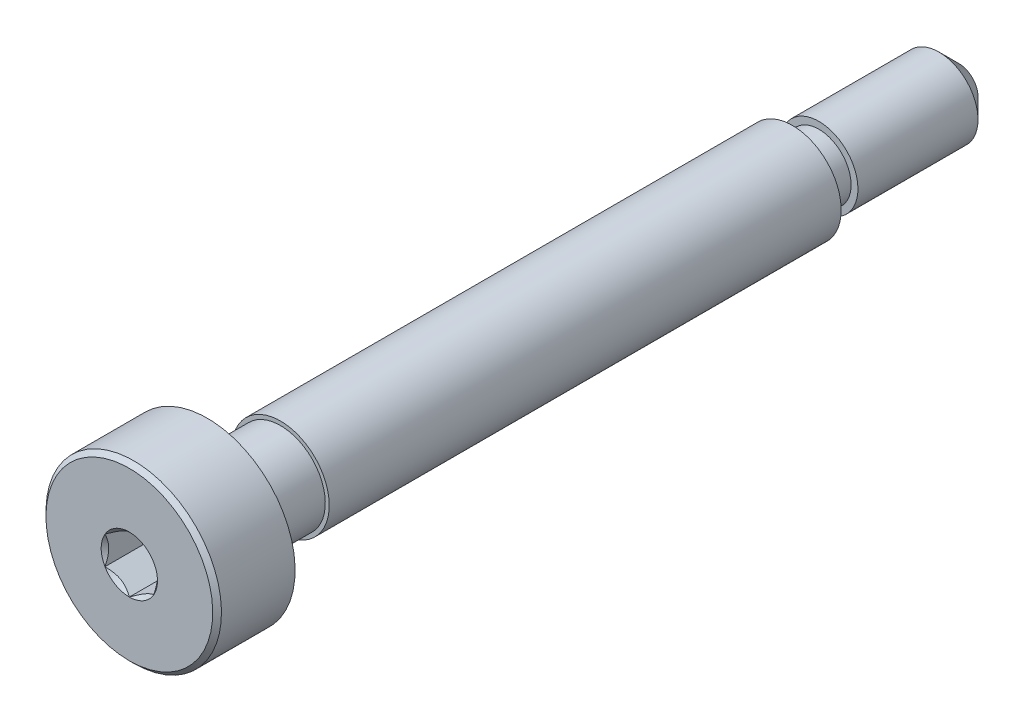
from build123d import *

# Parameters (mm, degrees)
CUT_EXTRUDE1_START = 21.267
CUT_EXTRUDE1_DEPTH = 2
CHAMFER2_SIZE      = 1.018261945


# Read off the part's stored shape, not the designer's step: Cut-Revolve-Thin1
with BuildPart() as part:
    # Sketch3 → Revolve1 (revolve)
    with BuildSketch(Plane(origin=(0, 0, 0), x_dir=(0, 0, -1), z_dir=(1, 0, 0)), mode=Mode.PRIVATE) as revolve1_sk:
        with BuildLine():
            Line((-21.267, 0), (-21.267, 4.2075))
            Line((-21.267, 4.2075), (-21.267, 4.5))
            Line((-21.267, 4.5), (-17.5595, 4.5))
            Line((-17.5595, 4.5), (-17.267, 4.5))
            Line((-17.267, 4.5), (-17.267, 2.297))
            Line((-17.267, 2.297), (-13.517, 2.297))
            Line((-13.517, 2.297), (-13.517, 2.5))
            Line((-13.517, 2.5), (12.733, 2.5))
            Line((12.733, 2.5), (12.733, 1.825397))
            ThreePointArc((12.733, 1.825397), (12.784140035, 1.701934035), (12.907603, 1.650794))
            Line((12.907603, 1.650794), (14.090682594, 1.650794))
            Line((14.090682594, 1.650794), (14.090682594, 2))
            Line((14.090682594, 2), (20.742, 2))
            Line((20.742, 2), (21.267, 2))
            Line((21.267, 2), (21.267, 0))
            Line((21.267, 0), (-21.267, 0))
        make_face()
    revolve(revolve1_sk.sketch.rotate(Axis((0, 0, 21.267), (0, 0, -1)), 180), axis=Axis((0, 0, 21.267), (0, 0, -1)))

    # Cut-Revolve-Thin1 outline → Cut-Revolve-Thin1 (revolve, cut)
    with BuildSketch(Plane.XZ):
        Polygon((2.258902438, 13.517431047), (1.961902438, -12.732568953), (2, -12.733), (2.297, 13.517), align=None)
    revolve(axis=Axis((0, 0, 0), (0, 0, 1)), mode=Mode.SUBTRACT)

    # Sketch4 → Cut-Extrude1 (cut)
    with BuildSketch(Plane.XY.offset(CUT_EXTRUDE1_START)):
        Polygon((0, 1.443375673), (-1.25, 0.721687836), (-1.25, -0.721687836), (0, -1.443375673), (1.25, -0.721687836), (1.25, 0.721687836), align=None)
    extrude(amount=-CUT_EXTRUDE1_DEPTH, mode=Mode.SUBTRACT)

    # Cut-Extrude2 cone 1 section (through the dimple's axis) → Cut-Extrude2 (revolve, cut)
    with BuildSketch(Plane(origin=(0, 0, 21.267), x_dir=(0, -1, 0), z_dir=(1, 0, 0))):
        Polygon((0, 0), (1.443375673, 0), (0, 1.443375673), align=None)
    revolve(axis=Axis((0, 0, 21.267), (0, 0, -1)), mode=Mode.SUBTRACT)

    # Chamfer2
    chamfer2_edges = [part.edges().sort_by_distance(p)[0] for p in [
        (0, 2, -21.267),
    ]]
    chamfer(chamfer2_edges, length=CHAMFER2_SIZE)

    # Sketch10 → Cut-Revolve2 (revolve, cut)
    with BuildSketch(Plane(origin=(0, 0, 0), x_dir=(0, 0, -1), z_dir=(1, 0, 0)), mode=Mode.PRIVATE) as cut_revolve2_sk:
        Polygon((-21.267, 4.275), (-21.042, 4.5), (-21.267, 4.5), align=None)
    revolve(cut_revolve2_sk.sketch.rotate(Axis((0, 0, 21.267), (0, 0, -1)), 180), axis=Axis((0, 0, 21.267), (0, 0, -1)), mode=Mode.SUBTRACT)


solid = part.part
